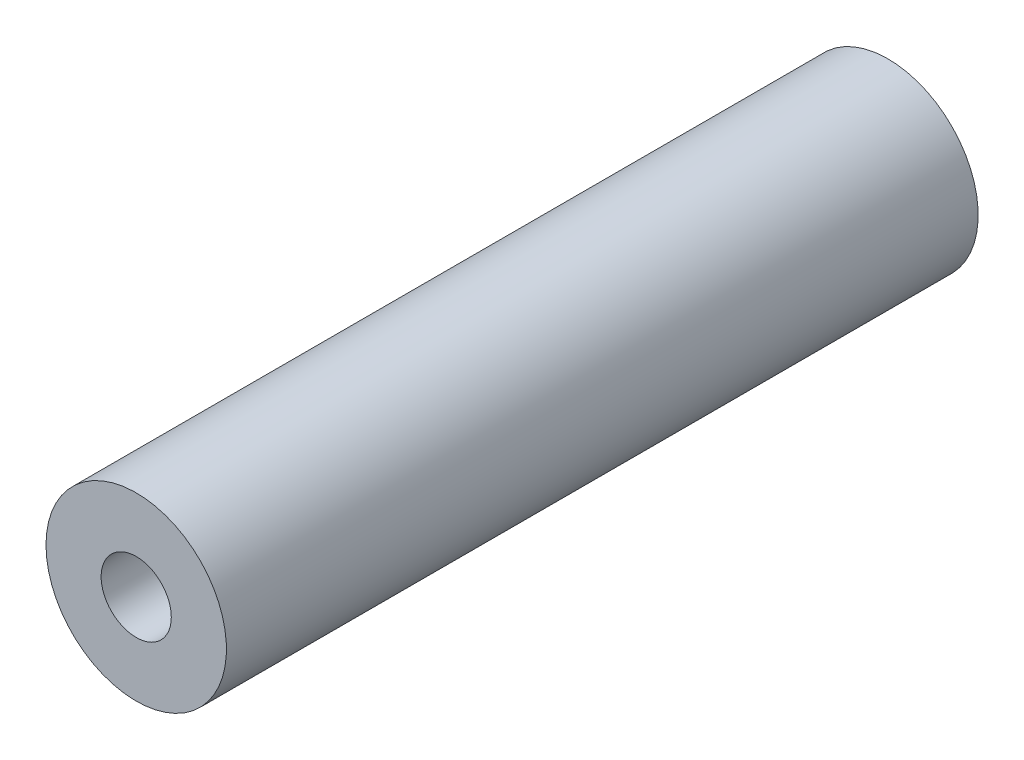
from build123d import *

# Parameters (mm, degrees)
ESBO_O1_R                = 5.4
RESSALTO_EXTRUS_O1_DEPTH = 45
PADR_OCIRCULAR1_COUNT    = 3


with BuildPart() as part:
    # Esboço1 → Ressalto-extrusão1 (new body)
    with BuildSketch(Plane.XY):
        Circle(ESBO_O1_R)
    extrude(amount=RESSALTO_EXTRUS_O1_DEPTH)

    # Esboço2 → Furo roscado de M51 (revolve, cut)
    with BuildSketch(Plane(origin=(0, 0, 45), x_dir=(0, -1, 0), z_dir=(1, 0, 0))):
        Polygon((0, 0), (0, 15.2618073), (2.1, 14), (2.1, 0), align=None)
    revolve(axis=Axis((0, 0, 51.35), (0, 0, -1)), mode=Mode.SUBTRACT)

    # Esboço6 → Furo roscado de M21 (revolve, cut)
    with BuildSketch(Plane(origin=(0, 3, 0), x_dir=(0, 1, 0), z_dir=(1, 0, 0))):
        Polygon((0, 0), (0, 8.480688495), (0.8, 8), (0.8, 0), align=None)
    furo_roscado_de_m21 = revolve(axis=Axis((0, 3, -6.35), (0, 0, 1)), mode=Mode.SUBTRACT)

    # PadrãoCircular1: Furo roscado de M21 ×3 about axis
    padr_ocircular1_axis = Axis((0, 0, 0), (0, 0, 1))
    for i in range(1, PADR_OCIRCULAR1_COUNT):
        add(furo_roscado_de_m21.rotate(padr_ocircular1_axis, i * 360 / PADR_OCIRCULAR1_COUNT), mode=Mode.SUBTRACT)


solid = part.part
